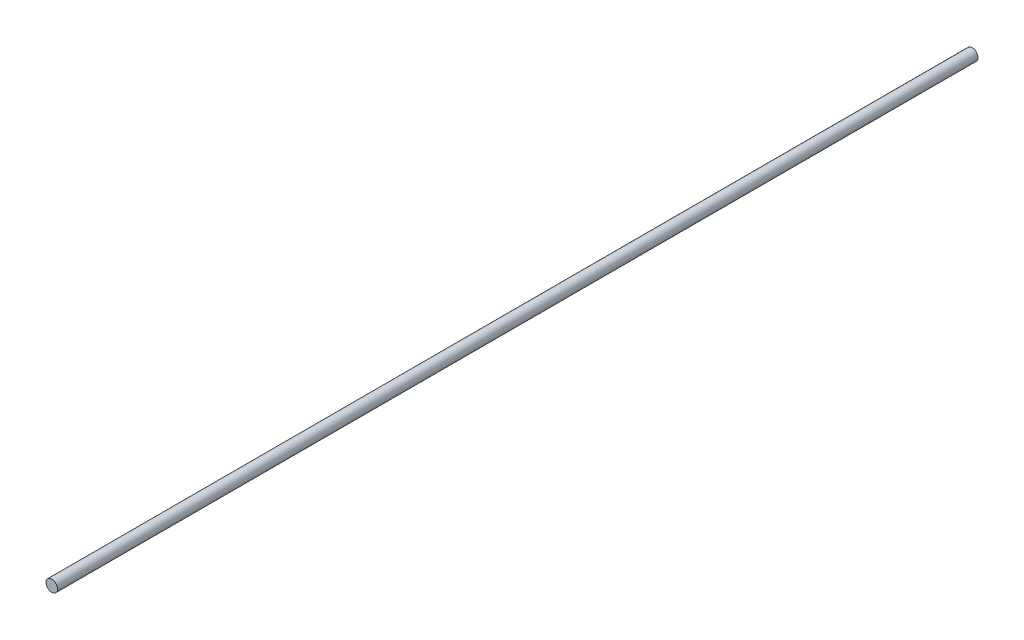
from build123d import *

# Parameters (mm, degrees)
SKETCH1_R           = 2
BOSS_EXTRUDE1_DEPTH = 320


with BuildPart() as part:
    # Sketch1 → Boss-Extrude1 (new body)
    with BuildSketch(Plane.XY):
        Circle(SKETCH1_R)
    extrude(amount=BOSS_EXTRUDE1_DEPTH)


solid = part.part
